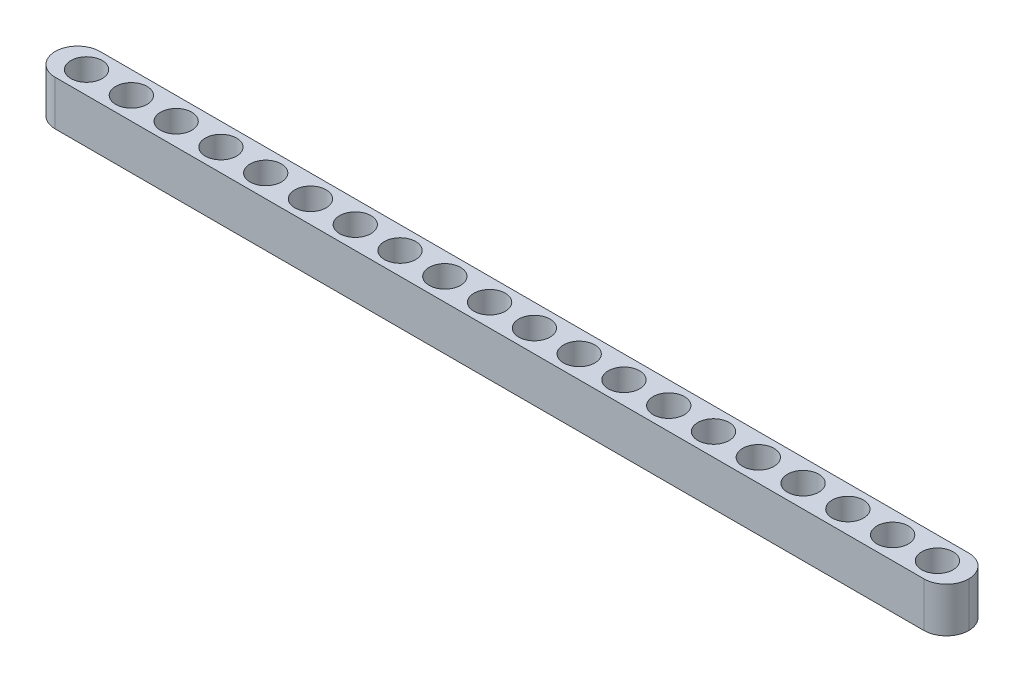
from build123d import *

# Parameters (mm, degrees)
SKETCH1_W           = 10
SKETCH1_H           = 10
BOSS_EXTRUDE1_DEPTH = 204
SKETCH2_R           = 3.5
CUT_EXTRUDE1_DEPTH  = 10
LPATTERN1_COUNT     = 20
LPATTERN1_PITCH     = 10
FILLET1_R           = 5


with BuildPart() as part:
    # Sketch1 → Boss-Extrude1 (new body)
    with BuildSketch(Plane(origin=(0, 0, 0), x_dir=(0, 0, -1), z_dir=(1, 0, 0))):
        with Locations((5, 5)):
            Rectangle(SKETCH1_W, SKETCH1_H)
    extrude(amount=BOSS_EXTRUDE1_DEPTH)

    # Sketch2 → Cut-Extrude1 (cut)
    with BuildSketch(Plane(origin=(0, 10, 0), x_dir=(1, 0, 0), z_dir=(0, 1, 0))):
        with Locations(Location((7, 5, 0), (0, 0, 270))):
            Circle(SKETCH2_R)
    cut_extrude1 = extrude(amount=-CUT_EXTRUDE1_DEPTH, mode=Mode.SUBTRACT)

    # LPattern1: Cut-Extrude1 ×20
    with Locations(*[(i * LPATTERN1_PITCH, 0, 0) for i in range(1, LPATTERN1_COUNT)]):
        add(cut_extrude1, mode=Mode.SUBTRACT)

    # Fillet1
    fillet1_edges = [part.edges().sort_by_distance(p)[0] for p in [
        (0, 5, 0),
        (0, 5, -10),
        (204, 5, 0),
        (204, 5, -10),
    ]]
    fillet(fillet1_edges, radius=FILLET1_R - 0.0001)  # a hair under: the kernel refuses the full size


solid = part.part
